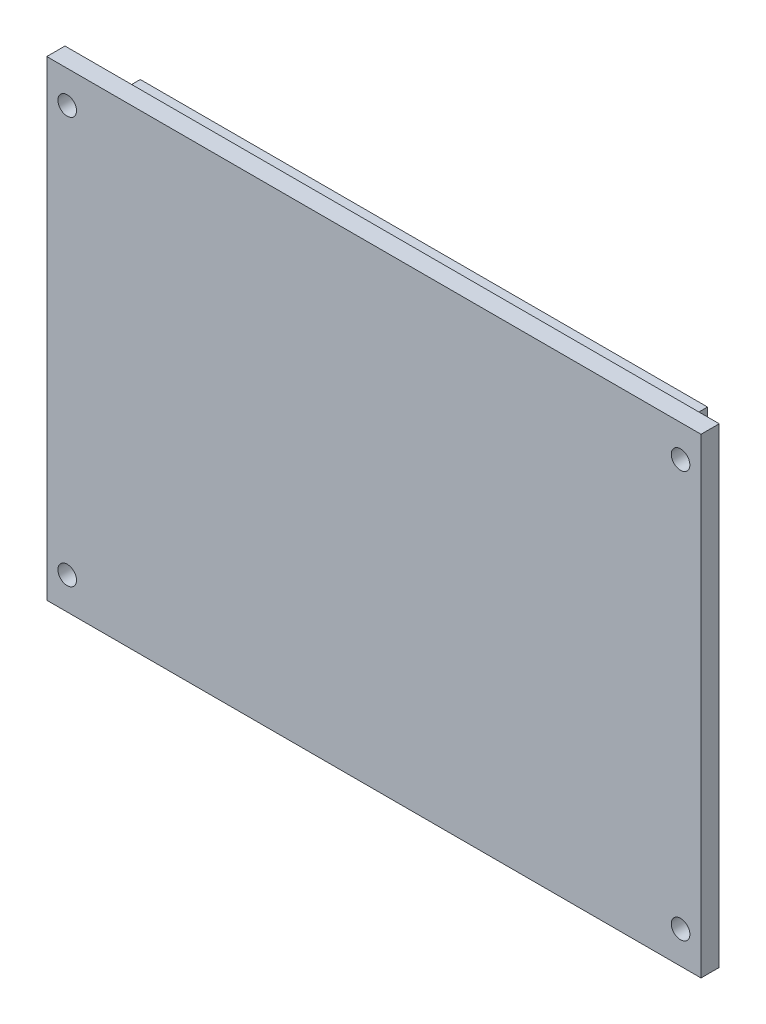
from build123d import *
from OCP.BRepFilletAPI import BRepFilletAPI_MakeChamfer

# Parameters (mm, degrees)
SKETCH1_R               = 172.5
BOSS_EXTRUDE1_DEPTH     = 10
SKETCH2_R               = 48.41
CUT_EXTRUDE1_DEPTH      = 10
BOSS_EXTRUDE2_DEPTH     = 5
CUT_EXTRUDE2_DEPTH      = 497
CUT_EXTRUDE6_START      = -497
CUT_EXTRUDE6_DEPTH      = 497
SKETCH6_W               = 195.767044214
SKETCH6_H               = 55
SKETCH6_W_2             = 185.767044214
SKETCH6_H_2             = 45
BOSS_EXTRUDE3_DEPTH     = 133.35
SKETCH7_W               = 185.767044214
SKETCH7_H               = 45
BOSS_EXTRUDE4_DEPTH     = 5
BOSS_EXTRUDE5_DEPTH     = 8
CHAMFER1_SIZE           = 8
CHAMFER1_SIZE2          = 6.250285012
CHAMFER1_PART_2_SIZE    = 8
CHAMFER1_PART_2_SIZE2   = 6.250285012
CHAMFER1_PART_3_SIZE    = 8
CHAMFER1_PART_3_SIZE2   = 6.250285012
FILLET1_R               = 38
SKETCH9_R               = 374.079334695
CUT_EXTRUDE7_DEPTH      = 93
CUT_EXTRUDE8_DEPTH      = 93
CUT_EXTRUDE8_DEPTH_BACK = 93
SKETCH10_R              = 229.38613092
SKETCH10_R_2            = 152.4
SKETCH11_W              = 291.443368419
SKETCH11_H              = 134.798764099
SKETCH11_W_2            = 144.967044214
SKETCH11_H_2            = 55
CUT_EXTRUDE9_DEPTH      = 143
SKETCH12_W              = 5
SKETCH12_H              = 55
BOSS_EXTRUDE6_DEPTH     = 133.35
SKETCH13_R              = 10
CUT_EXTRUDE10_DEPTH     = 58
SKETCH14_W              = 139.967044214
SKETCH14_H              = 45
BOSS_EXTRUDE7_DEPTH     = 5
SKETCH15_W              = 139.967044214
SKETCH15_H              = 123.35
CUT_EXTRUDE11_DEPTH     = 13
SKETCH16_W              = 10
SKETCH16_H              = 133.35
SKETCH16_W_2            = 149.967044214
BOSS_EXTRUDE9_DEPTH     = 17
SKETCH17_W              = 153.967044214
SKETCH17_H              = 115.6
SKETCH17_W_2            = 145.967044214
SKETCH17_H_2            = 107.6
CUT_EXTRUDE12_DEPTH     = 10
CHAMFER2_SIZE           = 10
CHAMFER2_SIZE2          = 5.773502692
SKETCH24_R              = 15
CUT_EXTRUDE16_DEPTH     = 177.5
SKETCH20_W              = 169.967044214
SKETCH20_H              = 3.35
CUT_EXTRUDE17_DEPTH     = 177.5
SKETCH25_W              = 139.967044214
SKETCH25_H              = 38.773502692
BOSS_EXTRUDE11_DEPTH    = 5
SKETCH26_W              = 3
SKETCH26_H              = 130
BOSS_EXTRUDE12_DEPTH    = 17
SKETCH18_R              = 2.5
CUT_EXTRUDE19_DEPTH     = 26
SKETCH27_W              = 152.567044214
SKETCH27_H              = 114.2
SKETCH27_W_2            = 147.367044214
SKETCH27_H_2            = 109
BOSS_EXTRUDE13_DEPTH    = 8.45
SKETCH27_W_3            = 138.567044214
SKETCH27_H_3            = 100.2
BOSS_EXTRUDE13_2_DEPTH  = 8.45
BOSS_EXTRUDE14_START    = 5
SKETCH28_W              = 175.967044214
SKETCH28_H              = 130
SKETCH28_R              = 2.5
BOSS_EXTRUDE14_DEPTH    = 5
SKETCH29_W              = 292.528596907
SKETCH29_H              = 171.315367969
CUT_EXTRUDE20_DEPTH     = 46.55
SKETCH30_W              = 175.967044214
SKETCH30_H              = 130
SKETCH30_W_2            = 153.967044214
SKETCH30_H_2            = 115.6
SKETCH30_W_3            = 145.967044214
SKETCH30_H_3            = 107.6
SKETCH30_W_4            = 138.567044214
SKETCH30_H_4            = 100.2
CUT_EXTRUDE23_DEPTH     = 8.55
SKETCH31_W              = 175.967044214
SKETCH31_H              = 17.196232217
CUT_EXTRUDE24_DEPTH     = 10


with BuildPart() as part:
    # Sketch1 → Boss-Extrude1 (new body)
    with BuildSketch(Plane(origin=(0, 0, 0), x_dir=(1, 0, 0), z_dir=(0, 1, 0))):
        with Locations(Location((0, 0, 0), (0, 0, 270))):
            Circle(SKETCH1_R)
    extrude(amount=BOSS_EXTRUDE1_DEPTH)

    # Sketch2 → Cut-Extrude1 (cut)
    with BuildSketch(Plane(origin=(0, 10, 0), x_dir=(1, 0, 0), z_dir=(0, 1, 0))):
        with Locations((-75.91, -178.72)):
            Circle(SKETCH2_R)
        with Locations((75.91, -178.72)):
            Circle(SKETCH2_R)
    extrude(amount=-CUT_EXTRUDE1_DEPTH, mode=Mode.SUBTRACT)

    # Sketch3 → Boss-Extrude2 (add)
    with BuildSketch(Plane(origin=(0, 10, 0), x_dir=(1, 0, 0), z_dir=(0, 1, 0))):
        with BuildLine():
            Line((-98.968297449, -119.81), (98.968297449, -119.81))
            ThreePointArc((98.968297449, -119.81), (0, 155.4), (-98.968297449, -119.81))
        make_face()
        with BuildLine():
            ThreePointArc((97.883522107, -116.81), (0, 152.4), (-97.883522107, -116.81))
            Line((-97.883522107, -116.81), (97.883522107, -116.81))
        make_face(mode=Mode.SUBTRACT)
    extrude(amount=BOSS_EXTRUDE2_DEPTH)

    # Sketch4 → Cut-Extrude2 (cut)
    with BuildSketch(Plane(origin=(0, 10, 0), x_dir=(1, 0, 0), z_dir=(0, 1, 0))):
        Polygon((-28.261160255, -170.169200565), (28.261160255, -170.169200565), (28.261160255, -183.836149753), (-30.300470404, -183.836149753), align=None)
    extrude(amount=-CUT_EXTRUDE2_DEPTH, mode=Mode.SUBTRACT)

    # Sketch5 → Cut-Extrude6 (cut)
    with BuildSketch(Plane(origin=(0, 10, 0), x_dir=(1, 0, 0), z_dir=(0, 1, 0)).offset(CUT_EXTRUDE6_START)):
        with BuildLine():
            ThreePointArc((26.702080818, 170.420799435), (0, 172.5), (-26.702080818, 170.420799435))
            Line((-26.702080818, 170.420799435), (26.702080818, 170.420799435))
        make_face()
        with BuildLine():
            ThreePointArc((166.525, -45.007492432), (172.5, 0), (166.525, 45.007492432))
            Line((166.525, 45.007492432), (166.525, -45.007492432))
        make_face()
        with BuildLine():
            Line((-166.525, -45.007492432), (-166.525, 45.007492432))
            ThreePointArc((-166.525, 45.007492432), (-172.5, 0), (-166.525, -45.007492432))
        make_face()
    extrude(amount=CUT_EXTRUDE6_DEPTH, mode=Mode.SUBTRACT)

    # Sketch6 → Boss-Extrude3 (add)
    with BuildSketch(Plane(origin=(0, 10, 0), x_dir=(1, 0, 0), z_dir=(0, 1, 0))):
        with Locations((0, -89.31)):
            Rectangle(SKETCH6_W, SKETCH6_H)
        with Locations((0, -89.31)):
            Rectangle(SKETCH6_W_2, SKETCH6_H_2, mode=Mode.SUBTRACT)
    extrude(amount=BOSS_EXTRUDE3_DEPTH)

    # Sketch7 → Boss-Extrude4 (add)
    with BuildSketch(Plane(origin=(0, 10, 0), x_dir=(1, 0, 0), z_dir=(0, 1, 0))):
        with Locations((0, -89.31)):
            Rectangle(SKETCH7_W, SKETCH7_H)
    extrude(amount=BOSS_EXTRUDE4_DEPTH)

    # Sketch8 → Boss-Extrude5 (add)
    with BuildSketch(Plane(origin=(0, 10, 0), x_dir=(1, 0, 0), z_dir=(0, 1, 0))):
        with BuildLine():
            Line((-97.883522107, -61.81), (-112.883522107, -61.81))
            Line((-112.883522107, -61.81), (-112.883522107, -101.267136509))
            ThreePointArc((-112.883522107, -101.267136509), (-105.634768892, -108.807252061), (-97.883522107, -115.829782871))
            Line((-97.883522107, -115.829782871), (-97.883522107, -61.81))
        make_face()
        with BuildLine():
            Line((-88.028513968, -46.81), (-88.028513968, -61.81))
            Line((-88.028513968, -61.81), (97.883522107, -61.81))
            Line((97.883522107, -61.81), (97.883522107, -115.829782871))
            ThreePointArc((97.883522107, -115.829782871), (105.634768892, -108.807252061), (112.883522107, -101.267136509))
            Line((112.883522107, -101.267136509), (112.883522107, -46.81))
            Line((112.883522107, -46.81), (-88.028513968, -46.81))
        make_face()
    extrude(amount=BOSS_EXTRUDE5_DEPTH)

    # Chamfer1
    chamfer1_edges = [part.edges().sort_by_distance(p)[0] for p in [
        (-97.883522107, 18, 88.819891436),
    ]]
    chamfer1_side = [part.faces().sort_by_distance(p)[0] for p in [
        (-97.883522107, 80.599247918, 89.340686997),
    ]]
    chamfer(chamfer1_edges, length=CHAMFER1_SIZE, length2=CHAMFER1_SIZE2, reference=chamfer1_side[0])

    # Chamfer1 part 2
    chamfer1_part_2_edges = [part.edges().sort_by_distance(p)[0] for p in [
        (4.927504069, 18, 61.81),
    ]]
    chamfer1_part_2_side = [part.faces().sort_by_distance(p)[0] for p in [
        (-0.807441513, 80.139082253, 61.81),
    ]]
    chamfer(chamfer1_part_2_edges, length=CHAMFER1_PART_2_SIZE, length2=CHAMFER1_PART_2_SIZE2, reference=chamfer1_part_2_side[0])

    # Chamfer1 part 3
    chamfer1_part_3_edges = [part.edges().sort_by_distance(p)[0] for p in [
        (97.883522107, 18, 88.819891436),
    ]]
    chamfer1_part_3_side = [part.faces().sort_by_distance(p)[0] for p in [
        (97.883522107, 80.599247918, 89.340686997),
    ]]
    chamfer(chamfer1_part_3_edges, length=CHAMFER1_PART_3_SIZE, length2=CHAMFER1_PART_3_SIZE2, reference=chamfer1_part_3_side[0])

    # Fillet1
    # the kernel refuses this fillet: 38 mm, written as the material it adds along each edge
    with BuildSketch(Plane(origin=(-97.883522107, 26, 148.028657271), x_dir=(-0.61566147532566, -0.7880107536067207, 0), z_dir=(0, 0, -1))) as fillet1_piece_1_section:
        with BuildLine():
            CenterArc((13.24591235, 37.873851244), FILLET1_R, 232, 33.330100487)
            Line((-10.149223713, 7.929442607), (0, 0))
            Line((0, 0), (10.152145721, 0))
        make_face()
    fillet1_piece_1 = extrude(amount=86.218657271, mode=Mode.PRIVATE)
    fillet1_piece_1 = fillet1_piece_1 & Plane(origin=(0, 26, 0), x_dir=(-0.7443687577094257, 0, 0.6677687867414337), z_dir=(0, -1, 0)) * Cylinder(151.65, 214, mode=Mode.PRIVATE)
    add(fillet1_piece_1)
    with BuildSketch(Plane(origin=(-88.028513968, 26, 61.81), x_dir=(0, 1, 0), z_dir=(1, 0, 0))) as fillet1_piece_2_section:
        with BuildLine():
            CenterArc((12.87954976, -38), FILLET1_R, 90, 33.330100487)
            Line((-8, -6.250285012), (0, 0))
            Line((0, 0), (12.87954976, 0))
        make_face()
    fillet1_piece_2 = extrude(amount=218.110910475, mode=Mode.PRIVATE)
    fillet1_piece_2 = fillet1_piece_2 - Plane(origin=(135.883522107, 38.87954976, 61.81), x_dir=(-0.8355188154722692, -0.5494618357919104, 0), z_dir=(0, 0, -1)) * Cylinder(38, 488, mode=Mode.PRIVATE)
    add(fillet1_piece_2)
    with BuildSketch(Plane(origin=(97.883522107, 26, 29.6111256), x_dir=(0.61566147532566, -0.7880107536067207, 0), z_dir=(0, 0, 1))) as fillet1_piece_3_section:
        with BuildLine():
            CenterArc((13.24591235, 37.873851244), FILLET1_R, 232, 33.330100487)
            Line((-10.149223713, 7.929442607), (0, 0))
            Line((0, 0), (10.152145721, 0))
        make_face()
    fillet1_piece_3 = extrude(amount=118.417531672, mode=Mode.PRIVATE)
    fillet1_piece_3 = fillet1_piece_3 & Plane(origin=(0, 26, 0), x_dir=(0.6454567893612635, 0, 0.7637967878090673), z_dir=(0, -1, 0)) * Cylinder(151.65, 278, mode=Mode.PRIVATE)
    fillet1_piece_3 = fillet1_piece_3 - Plane(origin=(97.883522107, 38.87954976, 23.81), x_dir=(0, 0, 1), z_dir=(-1, 0, 0)) * Cylinder(38, 278, mode=Mode.PRIVATE)
    add(fillet1_piece_3)

    # Sketch9 → Cut-Extrude7 (cut)
    with BuildSketch(Plane(origin=(0, 10, 0), x_dir=(1, 0, 0), z_dir=(0, 1, 0))):
        Circle(SKETCH9_R)
    extrude(amount=-CUT_EXTRUDE7_DEPTH, mode=Mode.SUBTRACT)

    # Sketch10 → Cut-Extrude8 (cut, two sides: drawn at the far end of the back side and taken through both)
    with BuildSketch(Plane.XZ.offset(-10).offset(-CUT_EXTRUDE8_DEPTH_BACK)):
        Circle(SKETCH10_R)
        Circle(SKETCH10_R_2, mode=Mode.SUBTRACT)
    extrude(amount=CUT_EXTRUDE8_DEPTH + CUT_EXTRUDE8_DEPTH_BACK, mode=Mode.SUBTRACT)

    # Sketch11 → Cut-Extrude9 (cut)
    with BuildSketch(Plane(origin=(0, 143.35, 0), x_dir=(1, 0, 0), z_dir=(0, 1, 0))):
        with Locations((4.840839595, -88.771460056)):
            Rectangle(SKETCH11_W, SKETCH11_H)
        with Locations((-25.4, -89.31)):
            Rectangle(SKETCH11_W_2, SKETCH11_H_2, mode=Mode.SUBTRACT)
    extrude(amount=-CUT_EXTRUDE9_DEPTH, mode=Mode.SUBTRACT)

    # Sketch12 → Boss-Extrude6 (add)
    with BuildSketch(Plane(origin=(0, 143.35, 0), x_dir=(1, 0, 0), z_dir=(0, 1, 0))):
        with Locations((49.583522107, -89.31)):
            Rectangle(SKETCH12_W, SKETCH12_H)
    extrude(amount=-BOSS_EXTRUDE6_DEPTH)

    # Sketch13 → Cut-Extrude10 (cut)
    with BuildSketch(Plane.ZY.offset(97.883522107)):
        with Locations((89.418847681, 75)):
            Circle(SKETCH13_R)
    extrude(amount=-CUT_EXTRUDE10_DEPTH, mode=Mode.SUBTRACT)

    # Sketch14 → Boss-Extrude7 (add)
    with BuildSketch(Plane(origin=(0, 143.35, 0), x_dir=(1, 0, 0), z_dir=(0, 1, 0))):
        with Locations((-22.9, -89.31)):
            Rectangle(SKETCH14_W, SKETCH14_H)
    extrude(amount=-BOSS_EXTRUDE7_DEPTH)

    # Sketch15 → Cut-Extrude11 (cut)
    with BuildSketch(Plane.XY.offset(116.81)):
        with Locations((-22.9, 76.675)):
            Rectangle(SKETCH15_W, SKETCH15_H)
    extrude(amount=-CUT_EXTRUDE11_DEPTH, mode=Mode.SUBTRACT)

    # Sketch16 → Boss-Extrude9 (add)
    # profile 1 of 5: a face of its own
    with BuildSketch(Plane.XY.offset(116.81)):
        with Locations((-102.883522107, 76.675)):
            Rectangle(SKETCH16_W, SKETCH16_H)
    # profile 2 of 5: a face of its own
    with BuildSketch(Plane.XY.offset(116.81)):
        with Locations((-22.9, 76.675)):
            Rectangle(SKETCH16_W_2, SKETCH16_H)
        Polygon((-92.883522107, 127.475), (-92.883522107, 138.35), (47.083522107, 138.35), (47.083522107, 127.475), (47.083522107, 76.675), (47.083522107, 25.875), (47.083522107, 15), (-92.883522107, 15), (-92.883522107, 25.875), (-92.883522107, 76.675), align=None, mode=Mode.SUBTRACT)
    # profile 3 of 5: a face of its own
    with BuildSketch(Plane.XY.offset(116.81)):
        with Locations((57.083522107, 76.675)):
            Rectangle(SKETCH16_W, SKETCH16_H)
    # profile 4 of 5: a face of its own
    with BuildSketch(Plane.XY.offset(116.81)):
        Polygon((47.083522107, 138.35), (-92.883522107, 138.35), (-92.883522107, 127.475), (-22.9, 127.475), (47.083522107, 127.475), align=None)
    # profile 5 of 5: a face of its own
    with BuildSketch(Plane.XY.offset(116.81)):
        Polygon((-22.9, 25.875), (-92.883522107, 25.875), (-92.883522107, 15), (47.083522107, 15), (47.083522107, 25.875), align=None)
    extrude(amount=-BOSS_EXTRUDE9_DEPTH)

    # Sketch17 → Cut-Extrude12 (cut)
    with BuildSketch(Plane.XY.offset(116.81)):
        with Locations((-22.9, 76.675)):
            Rectangle(SKETCH17_W, SKETCH17_H)
        with Locations((-22.9, 76.675)):
            Rectangle(SKETCH17_W_2, SKETCH17_H_2, mode=Mode.SUBTRACT)
    extrude(amount=-CUT_EXTRUDE12_DEPTH, mode=Mode.SUBTRACT)

    # Chamfer2: one chamfer whose edges measure the first distance from different faces: ONE call of the kernel's chamfer builder (chamfer() names one face for all edges)
    chamfer2_edges_1 = [part.edges().sort_by_distance(p)[0] for p in [
        (-22.9, 25.875, 99.81),
    ]]
    chamfer2_side_1 = [part.faces().sort_by_distance(p)[0] for p in [
        (-22.9, 25.875, 108.31),
    ]]
    chamfer2_edges_2 = [part.edges().sort_by_distance(p)[0] for p in [
        (-22.9, 127.475, 99.81),
    ]]
    chamfer2_side_2 = [part.faces().sort_by_distance(p)[0] for p in [
        (-22.9, 132.9125, 99.81),
    ]]
    chamfer2 = BRepFilletAPI_MakeChamfer(part.part.solid().wrapped)
    for e in chamfer2_edges_1:
        chamfer2.Add(CHAMFER2_SIZE, CHAMFER2_SIZE2, e.wrapped, chamfer2_side_1[0].wrapped)  # the first distance lies on this face
    for e in chamfer2_edges_2:
        chamfer2.Add(CHAMFER2_SIZE, CHAMFER2_SIZE2, e.wrapped, chamfer2_side_2[0].wrapped)  # the first distance lies on this face
    add(Compound.cast(chamfer2.Shape()), mode=Mode.REPLACE)

    # Sketch24 → Cut-Extrude16 (cut)
    with BuildSketch(Plane.ZY.offset(97.883522107)):
        with Locations((83.81, 75)):
            Circle(SKETCH24_R)
    extrude(amount=-CUT_EXTRUDE16_DEPTH, mode=Mode.SUBTRACT)

    # Sketch20 → Cut-Extrude17 (cut)
    with BuildSketch(Plane.XY.offset(116.81)):
        with Locations((-22.9, 11.675)):
            Rectangle(SKETCH20_W, SKETCH20_H)
    extrude(amount=-CUT_EXTRUDE17_DEPTH, mode=Mode.SUBTRACT)

    # Sketch25 → Boss-Extrude11 (add)
    with BuildSketch(Plane(origin=(0, 13.35, 0), x_dir=(-1, 0, 0), z_dir=(0, -1, 0))):
        with Locations((22.9, -86.196751346)):
            Rectangle(SKETCH25_W, SKETCH25_H)
    extrude(amount=-BOSS_EXTRUDE11_DEPTH)

    # Sketch26 → Boss-Extrude12 (add)
    with BuildSketch(Plane.XY.offset(116.81)):
        with Locations((-109.383522107, 78.35)):
            Rectangle(SKETCH26_W, SKETCH26_H)
        with Locations((63.583522107, 78.35)):
            Rectangle(SKETCH26_W, SKETCH26_H)
    extrude(amount=-BOSS_EXTRUDE12_DEPTH)

    # Sketch18 → Cut-Extrude19 (cut)
    with BuildSketch(Plane.XY.offset(116.81)):
        with Locations((-105.383522107, 22)):
            Circle(SKETCH18_R)
        with Locations((59.583522107, 22)):
            Circle(SKETCH18_R)
        with Locations((59.583522107, 131.35)):
            Circle(SKETCH18_R)
        with Locations((-105.383522107, 131.35)):
            Circle(SKETCH18_R)
    extrude(amount=-CUT_EXTRUDE19_DEPTH, mode=Mode.SUBTRACT)



with BuildPart() as body_2:
    # Sketch27 → Boss-Extrude13 (new body)
    with BuildSketch(Plane.XY.offset(116.81)):
        with Locations((-22.9, 76.675)):
            Rectangle(SKETCH27_W, SKETCH27_H)
        with Locations((-22.9, 76.675)):
            Rectangle(SKETCH27_W_2, SKETCH27_H_2, mode=Mode.SUBTRACT)
    extrude(amount=-BOSS_EXTRUDE13_DEPTH)


with BuildPart() as body_3:
    # Sketch27 → Boss-Extrude13 2 (new body)
    with BuildSketch(Plane.XY.offset(116.81)):
        with Locations((-22.9, 76.675)):
            Rectangle(SKETCH27_W_3, SKETCH27_H_3)
    extrude(amount=-BOSS_EXTRUDE13_2_DEPTH)


with BuildPart() as part_1:
    add(part.part)

    add(body_2.part)  # Boss-Extrude14 merges body 2

    add(body_3.part)  # Boss-Extrude14 merges body 3
    # Sketch28 → Boss-Extrude14 (add)
    with BuildSketch(Plane.XY.offset(116.81).offset(BOSS_EXTRUDE14_START)):
        with Locations((-22.9, 78.35)):
            Rectangle(SKETCH28_W, SKETCH28_H)
        with Locations((-105.383522107, 131.35)):
            Circle(SKETCH28_R, mode=Mode.SUBTRACT)
        with Locations((59.583522107, 131.35)):
            Circle(SKETCH28_R, mode=Mode.SUBTRACT)
        with Locations((59.583522107, 22)):
            Circle(SKETCH28_R, mode=Mode.SUBTRACT)
        with Locations((-105.383522107, 22)):
            Circle(SKETCH28_R, mode=Mode.SUBTRACT)
    extrude(amount=-BOSS_EXTRUDE14_DEPTH)

    # Sketch29 → Cut-Extrude20 (cut)
    with BuildSketch(Plane(origin=(0, 0, 61.81), x_dir=(-1, 0, 0), z_dir=(0, 0, -1))):
        with Locations((7.671703237, 74.887303123)):
            Rectangle(SKETCH29_W, SKETCH29_H)
    extrude(amount=-CUT_EXTRUDE20_DEPTH, mode=Mode.SUBTRACT)

    # Sketch30 → Cut-Extrude23 (cut)
    # profile 1 of 2: a face of its own
    with BuildSketch(Plane(origin=(0, 0, 108.36), x_dir=(-1, 0, 0), z_dir=(0, 0, -1))):
        with Locations((22.9, 78.35)):
            Rectangle(SKETCH30_W, SKETCH30_H)
        with Locations((22.9, 76.675)):
            Rectangle(SKETCH30_W_2, SKETCH30_H_2, mode=Mode.SUBTRACT)
    # profile 2 of 2: a face of its own
    with BuildSketch(Plane(origin=(0, 0, 108.36), x_dir=(-1, 0, 0), z_dir=(0, 0, -1))):
        with Locations((22.9, 76.675)):
            Rectangle(SKETCH30_W_3, SKETCH30_H_3)
        with Locations((22.9, 76.675)):
            Rectangle(SKETCH30_W_4, SKETCH30_H_4, mode=Mode.SUBTRACT)
    extrude(amount=-CUT_EXTRUDE23_DEPTH, mode=Mode.SUBTRACT)

    # Sketch31 → Cut-Extrude24 (cut)
    with BuildSketch(Plane(origin=(0, 0, 116.91), x_dir=(-1, 0, 0), z_dir=(0, 0, -1))):
        with Locations((22.9, 4.751883892)):
            Rectangle(SKETCH31_W, SKETCH31_H)
        with Locations((22.9, 148.598116108)):
            Rectangle(SKETCH31_W, SKETCH31_H)
    extrude(amount=-CUT_EXTRUDE24_DEPTH, mode=Mode.SUBTRACT)


solid = part_1.part
